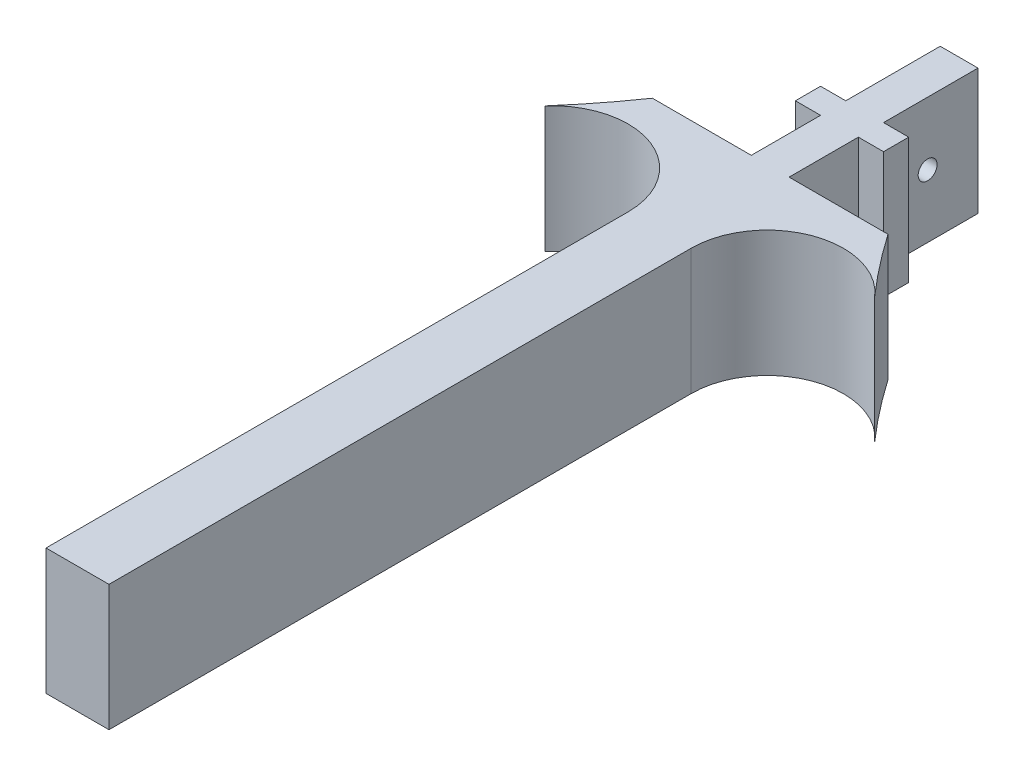
from build123d import *

# Parameters (mm, degrees)
BOSS_EXTRU_1_DEPTH      = 20
ESQUISSE3_R             = 1.5
ENL_V_MAT_EXTRU_3_DEPTH = 20


with BuildPart() as part:
    # Esquisse1 → Boss.-Extru.1 (new body)
    with BuildSketch(Plane(origin=(0, 0, 0), x_dir=(1, 0, 0), z_dir=(0, 1, 0))):
        with BuildLine():
            Line((-3, 84.398281038), (-3, 69.398281038))
            Line((-3, 69.398281038), (-7, 69.398281038))
            Line((-7, 69.398281038), (-7, 65.398281038))
            Line((-7, 65.398281038), (-3, 65.398281038))
            Line((-3, 65.398281038), (-3, 54.398281038))
            Line((-3, 54.398281038), (-18.71, 54.398281038))
            ThreePointArc((-18.71, 54.398281038), (-22.308577777, 49.499317693), (-26.183329952, 44.81574006))
            ThreePointArc((-26.183329952, 44.81574006), (-12.83252844, 48.159570073), (-5, 36.842476876))
            Line((-5, 36.842476876), (-5, -55.601718962))
            Line((-5, -55.601718962), (0, -55.601718962))
            Line((0, -55.601718962), (0, 84.398281038))
            Line((0, 84.398281038), (-3, 84.398281038))
        make_face()
    boss_extru_1 = extrude(amount=BOSS_EXTRU_1_DEPTH)

    # Symétrie1: Boss.-Extru.1 across plane
    add(boss_extru_1.mirror(Plane(origin=(0, 20, -84.398281038), x_dir=(0, 0, 1), z_dir=(-1, 0, 0))))

    # Esquisse3 → Enlèv. mat.-Extru.3 (cut)
    with BuildSketch(Plane.ZY.offset(3)):
        with Locations((-76.398281038, 10)):
            Circle(ESQUISSE3_R)
        with Locations((-60.398281038, 10)):
            Circle(ESQUISSE3_R)
    extrude(amount=-ENL_V_MAT_EXTRU_3_DEPTH, mode=Mode.SUBTRACT)


solid = part.part
